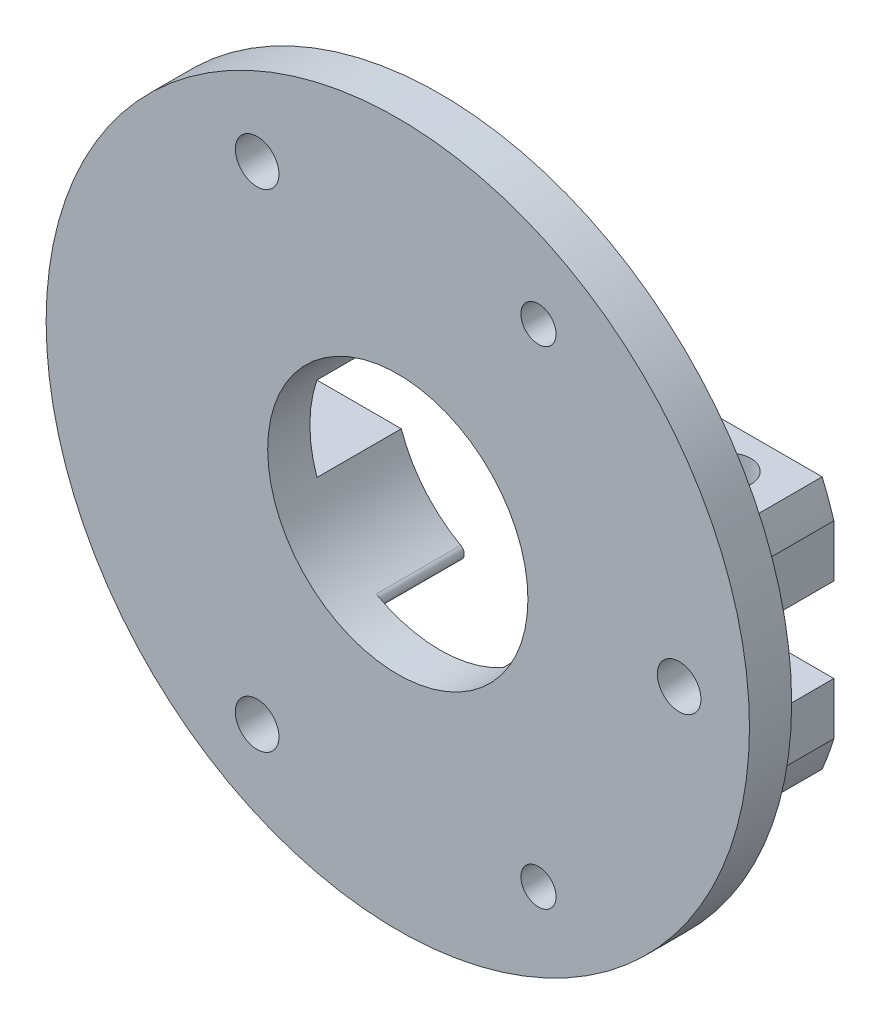
from build123d import *
from build123d.topology import SkipClean

# Parameters (mm, degrees)
SKETCH_1_R               = 23
SKETCH_1_R_2             = 9.25
EXTRUDE_1_DEPTH          = 3
EXTRUDE_START            = 6
EXTRUDE_2_DEPTH          = 6
SKETCH_3_R               = 1.6
CUT_EXTRUDE_1_DEPTH      = 40.862262856
FILLET_3_R               = 0.5
SKETCH_4_R               = 25
SKETCH_4_R_2             = 23
CUT_EXTRUDE_2_DEPTH      = 10
SKETCH_5_R               = 25
SKETCH_5_R_2             = 9.25
EXTRUDE_3_DEPTH          = 3
PATTERN_CIRCULAR_1_COUNT = 3
SKETCH_12_R              = 3
SKETCH_12_R_2            = 1.55
EXTRUDE_4_DEPTH          = 2
HOLE_WIZARD_M3_1_D       = 2.5
HOLE_WIZARD_M3_1_DEPTH   = 12.5
HOLE_WIZARD_M3_1_TIP     = 0.751075774
SKETCH_16_R              = 3
SKETCH_16_R_2            = 1.55
EXTRUDE_5_DEPTH          = 3


with BuildPart() as part:
    # 草图1 → 凸台-拉伸1 (new body)
    with BuildSketch(Plane.XY):
        Circle(SKETCH_1_R)
        Circle(SKETCH_1_R_2, mode=Mode.SUBTRACT)
    extrude(amount=EXTRUDE_1_DEPTH)

    # 草图2 → 凸台-拉伸2 (add)
    with BuildSketch(Plane(origin=(0, 0, 0), x_dir=(-1, 0, 0), z_dir=(0, 0, -1)).offset(EXTRUDE_START)):
        with BuildLine():
            Line((22, 9), (2.136000936, 9))
            ThreePointArc((2.136000936, 9), (6.215002341, 6.851003277), (8.75, 3))
            Line((8.75, 3), (22, 3))
            Line((22, 3), (22, 9))
        make_face()
        with BuildLine():
            Line((-22, 9), (-22, 3))
            Line((-22, 3), (-8.75, 3))
            ThreePointArc((-8.75, 3), (-6.215002341, 6.851003277), (-2.136000936, 9))
            Line((-2.136000936, 9), (-22, 9))
        make_face()
        with BuildLine():
            Line((22, -3), (8.75, -3))
            ThreePointArc((8.75, -3), (6.215002341, -6.851003277), (2.136000936, -9))
            Line((2.136000936, -9), (22, -9))
            Line((22, -9), (22, -3))
        make_face()
        with BuildLine():
            Line((-22, -9), (-2.136000936, -9))
            ThreePointArc((-2.136000936, -9), (-6.215002341, -6.851003277), (-8.75, -3))
            Line((-8.75, -3), (-22, -3))
            Line((-22, -3), (-22, -9))
        make_face()
    extrude(amount=-EXTRUDE_2_DEPTH)

    # 草图3 → 切除-拉伸1 (cut, through all)
    with BuildSketch(Plane.XZ.offset(9)):
        with Locations(Location((-17.5, -3, 0), (0, 0, 270))):
            Circle(SKETCH_3_R)
        with Locations(Location((17.5, -3, 0), (0, 0, 270))):
            Circle(SKETCH_3_R)
    extrude(amount=-CUT_EXTRUDE_1_DEPTH, mode=Mode.SUBTRACT)

    # 圆角3
    # the kernel refuses this fillet: 0.5 mm, written as the material it takes off along each edge
    with BuildSketch(Plane(origin=(2.136000936, 9, -12.600605893), x_dir=(0.9314269408293101, -0.36392836368899956, 0), z_dir=(0, 0, 1))) as fillet_3_piece_1:
        with BuildLine():
            CenterArc((2.641157044, 0.49514561), FILLET_3_R, 111.34164725, 150.667889832)
            Line((2.459192862, 0.960859081), (0, 0))
            ThreePointArc((0, 0), (1.285826456, 0.089806207), (2.571652911, 0))
        make_face()
    extrude(amount=12.600605893, mode=Mode.SUBTRACT)
    with BuildSketch(Plane(origin=(-2.136000936, 9, -12.600605893), x_dir=(-0.931426940829308, -0.3639283636890051, 0), z_dir=(0, 0, 1))) as fillet_3_piece_2:
        with BuildLine():
            CenterArc((2.641157044, -0.49514561), FILLET_3_R, 97.990462918, 150.667889832)
            Line((2.459192862, -0.960859081), (0, 0))
            ThreePointArc((0, 0), (1.285826456, -0.089806207), (2.571652911, 0))
        make_face()
    extrude(amount=12.600605893, mode=Mode.SUBTRACT)
    with BuildSketch(Plane(origin=(-2.136000936, -9, -12.600605893), x_dir=(-1, 0, 0), z_dir=(0, 0, 1))) as fillet_3_piece_3:
        with BuildLine():
            CenterArc((2.640242357, -0.5), FILLET_3_R, 90, 150.667889832)
            ThreePointArc((2.395306804, -0.935897436), (1.230336428, -0.384300797), (0, 0))
            Line((0, 0), (2.640242357, 0))
        make_face()
    extrude(amount=12.600605893, mode=Mode.SUBTRACT)
    with BuildSketch(Plane(origin=(2.136000936, -9, -12.600605893), x_dir=(1, 0, 0), z_dir=(0, 0, 1))) as fillet_3_piece_4:
        with BuildLine():
            CenterArc((2.640242357, 0.5), FILLET_3_R, 119.332110168, 150.667889832)
            ThreePointArc((2.395306804, 0.935897436), (1.230336428, 0.384300797), (0, 0))
            Line((0, 0), (2.640242357, 0))
        make_face()
    extrude(amount=12.600605893, mode=Mode.SUBTRACT)

    # 草图4 → 切除-拉伸2 (cut)
    with SkipClean():  # the faces are left unmerged after this step: merging them gives an invalid solid
        with BuildSketch(Plane(origin=(0, 0, -6), x_dir=(-1, 0, 0), z_dir=(0, 0, -1))):
            Circle(SKETCH_4_R)
            with Locations(Location((0, 0, 0), (0, 0, 16.957426294))):
                Circle(SKETCH_4_R_2, mode=Mode.SUBTRACT)
        extrude(amount=-CUT_EXTRUDE_2_DEPTH, mode=Mode.SUBTRACT)
    add(part.part.scale(1), mode=Mode.REPLACE)  # the faces are merged on a copy

    # 草图5 → 凸台-拉伸3 (add)
    with SkipClean():  # the faces are left unmerged after this step: merging them gives an invalid solid
        with BuildSketch(Plane.XY):
            Circle(SKETCH_5_R)
            with Locations(Location((0, 0, 0), (0, 0, 198.924644416))):
                Circle(SKETCH_5_R_2, mode=Mode.SUBTRACT)
        extrude(amount=EXTRUDE_3_DEPTH)
    add(part.part.scale(1), mode=Mode.REPLACE)  # the faces are merged on a copy

    # 草图11 → 切除-旋转1 (revolve, cut)
    with BuildSketch(Plane(origin=(0, 0, 0), x_dir=(1, 0, 0), z_dir=(0, 1, 0))):
        Polygon((21.55, -3), (21.55, -1.45), (23, 0), (20, 0), (20, -3), align=None)
    cut_revolve_1 = revolve(axis=Axis((20, 0, 8.062210134), (0, 0, -1)), mode=Mode.SUBTRACT)

    # 阵列(圆周)1: 切除-旋转1 ×3 about axis
    pattern_circular_1_axis = Axis((0, 0, 0), (0, 0, 1))
    for i in range(1, PATTERN_CIRCULAR_1_COUNT):
        add(cut_revolve_1.rotate(pattern_circular_1_axis, i * 360 / PATTERN_CIRCULAR_1_COUNT), mode=Mode.SUBTRACT)

    # 草图12 → 凸台-拉伸4 (add)
    # profile 1 of 2: a face of its own
    with BuildSketch(Plane(origin=(0, 0, 0), x_dir=(-1, 0, 0), z_dir=(0, 0, -1))):
        with Locations((10, 17.320508076)):
            Circle(SKETCH_12_R)
        with Locations(Location((10, 17.320508076, 0), (0, 0, 60))):
            Circle(SKETCH_12_R_2, mode=Mode.SUBTRACT)
    # profile 2 of 2: a face of its own
    with BuildSketch(Plane(origin=(0, 0, 0), x_dir=(-1, 0, 0), z_dir=(0, 0, -1))):
        with Locations((10, -17.320508076)):
            Circle(SKETCH_12_R)
        with Locations(Location((10, -17.320508076, 0), (0, 0, 300))):
            Circle(SKETCH_12_R_2, mode=Mode.SUBTRACT)
    extrude(amount=-EXTRUDE_4_DEPTH)

    # M3 螺纹孔1
    with Locations(Plane(origin=(0, 0, 0), x_dir=(-1, 0, 0), z_dir=(0, 0, -1))):
        with Locations((-10, 17.320508076), (-10, -17.320508076)):
            Hole(HOLE_WIZARD_M3_1_D / 2, depth=HOLE_WIZARD_M3_1_DEPTH)
            with Locations((0, 0, -(HOLE_WIZARD_M3_1_DEPTH + HOLE_WIZARD_M3_1_TIP / 2))):  # 118° drill point
                Cone(0, HOLE_WIZARD_M3_1_D / 2, HOLE_WIZARD_M3_1_TIP, mode=Mode.SUBTRACT)

    # 草图16 → 凸台-拉伸5 (add)
    with BuildSketch(Plane(origin=(0, 0, 0), x_dir=(-1, 0, 0), z_dir=(0, 0, -1))):
        with Locations((-20, 0)):
            Circle(SKETCH_16_R)
        with Locations(Location((-20, 0, 0), (0, 0, 180))):
            Circle(SKETCH_16_R_2, mode=Mode.SUBTRACT)
    extrude(amount=-EXTRUDE_5_DEPTH)


solid = part.part
